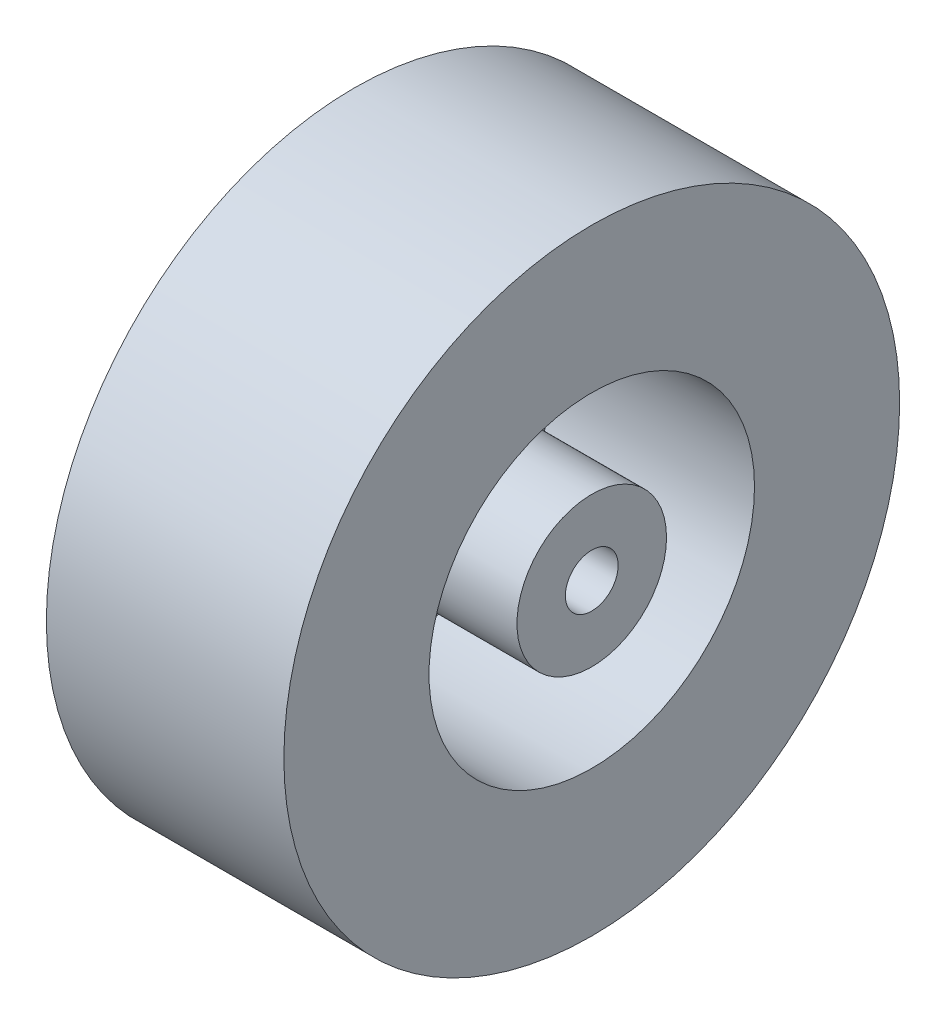
from build123d import *

# Parameters (mm, degrees)
SKETCH1_R           = 35
BOSS_EXTRUDE1_DEPTH = 27
CUT_EXTRUDE1_REACH  = 58.383
SKETCH2_R           = 3
SKETCH3_R           = 18.5
SKETCH3_R_2         = 8.5
CUT_EXTRUDE2_DEPTH  = 23


with BuildPart() as part:
    # Sketch1 → Boss-Extrude1 (new body)
    with BuildSketch(Plane(origin=(0, 0, 0), x_dir=(0, 0, -1), z_dir=(1, 0, 0))):
        Circle(SKETCH1_R)
    extrude(amount=BOSS_EXTRUDE1_DEPTH)

    # Sketch2 → Cut-Extrude1 (cut, up to next)
    with BuildSketch(Plane.ZY, mode=Mode.PRIVATE) as cut_extrude1_sk1:
        Circle(SKETCH2_R)
    cut_extrude1_tool1 = extrude(cut_extrude1_sk1.sketch, amount=-CUT_EXTRUDE1_REACH, mode=Mode.PRIVATE) & part.part
    add(cut_extrude1_tool1.solids().sort_by_distance((0, 0, 0))[0], mode=Mode.SUBTRACT)

    # Sketch3 → Cut-Extrude2 (cut)
    with BuildSketch(Plane(origin=(27, 0, 0), x_dir=(0, 0, -1), z_dir=(1, 0, 0))):
        Circle(SKETCH3_R)
        Circle(SKETCH3_R_2, mode=Mode.SUBTRACT)
    extrude(amount=-CUT_EXTRUDE2_DEPTH, mode=Mode.SUBTRACT)


solid = part.part
